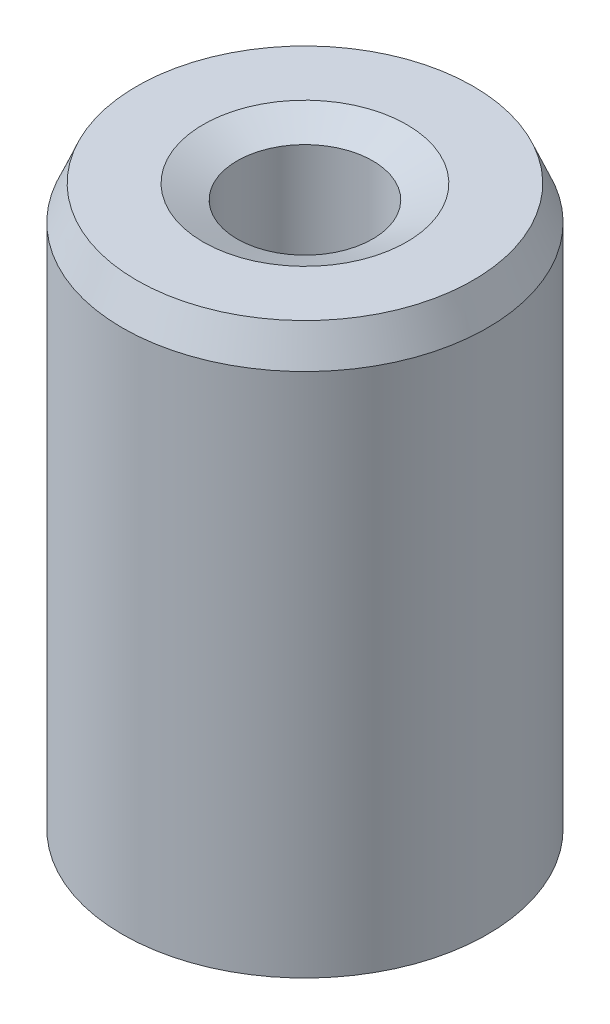
from build123d import *
from OCP.BRepFilletAPI import BRepFilletAPI_MakeChamfer

# Parameters (mm, degrees)
SKETCH1_R           = 5
BOSS_EXTRUDE1_DEPTH = 15.711829167
SKETCH2_R           = 1.856342713
CUT_EXTRUDE1_DEPTH  = 18.229671378
CHAMFER1_SIZE       = 0.931205737
CHAMFER1_SIZE2      = 0.394113275


with BuildPart() as part:
    # Sketch1 → Boss-Extrude1 (new body)
    with BuildSketch(Plane(origin=(0, 0, 0), x_dir=(1, 0, 0), z_dir=(0, 1, 0))):
        Circle(SKETCH1_R)
    extrude(amount=BOSS_EXTRUDE1_DEPTH)

    # Sketch2 → Cut-Extrude1 (cut, through all)
    with BuildSketch(Plane(origin=(0, 0, 0), x_dir=(1, 0, 0), z_dir=(0, 1, 0))):
        Circle(SKETCH2_R)
    extrude(amount=CUT_EXTRUDE1_DEPTH, mode=Mode.SUBTRACT)

    # Chamfer1: one chamfer whose edges measure the first distance from different faces: ONE call of the kernel's chamfer builder (chamfer() names one face for all edges)
    chamfer1_edges_1 = [part.edges().sort_by_distance(p)[0] for p in [
        (-1.856342713, 15.711829167, 0),
    ]]
    chamfer1_side_1 = [part.faces().sort_by_distance(p)[0] for p in [
        (-4.858578644, 15.711829167, 0),
    ]]
    chamfer1_edges_2 = [part.edges().sort_by_distance(p)[0] for p in [
        (-1.856342713, 0, 0),
    ]]
    chamfer1_side_2 = [part.faces().sort_by_distance(p)[0] for p in [
        (-1.856342713, 7.855914584, 0),
    ]]
    chamfer1_edges_3 = [part.edges().sort_by_distance(p)[0] for p in [
        (-5, 0, 0),
    ]]
    chamfer1_side_3 = [part.faces().sort_by_distance(p)[0] for p in [
        (-4.858578644, 0, 0),
    ]]
    chamfer1_edges_4 = [part.edges().sort_by_distance(p)[0] for p in [
        (-5, 15.711829167, 0),
    ]]
    chamfer1_side_4 = [part.faces().sort_by_distance(p)[0] for p in [
        (-5, 7.855914584, 0),
    ]]
    chamfer1 = BRepFilletAPI_MakeChamfer(part.part.solid().wrapped)
    for e in chamfer1_edges_1:
        chamfer1.Add(CHAMFER1_SIZE, CHAMFER1_SIZE2, e.wrapped, chamfer1_side_1[0].wrapped)  # the first distance lies on this face
    for e in chamfer1_edges_2:
        chamfer1.Add(CHAMFER1_SIZE, CHAMFER1_SIZE2, e.wrapped, chamfer1_side_2[0].wrapped)  # the first distance lies on this face
    for e in chamfer1_edges_3:
        chamfer1.Add(CHAMFER1_SIZE, CHAMFER1_SIZE2, e.wrapped, chamfer1_side_3[0].wrapped)  # the first distance lies on this face
    for e in chamfer1_edges_4:
        chamfer1.Add(CHAMFER1_SIZE, CHAMFER1_SIZE2, e.wrapped, chamfer1_side_4[0].wrapped)  # the first distance lies on this face
    add(Compound.cast(chamfer1.Shape()), mode=Mode.REPLACE)


solid = part.part
